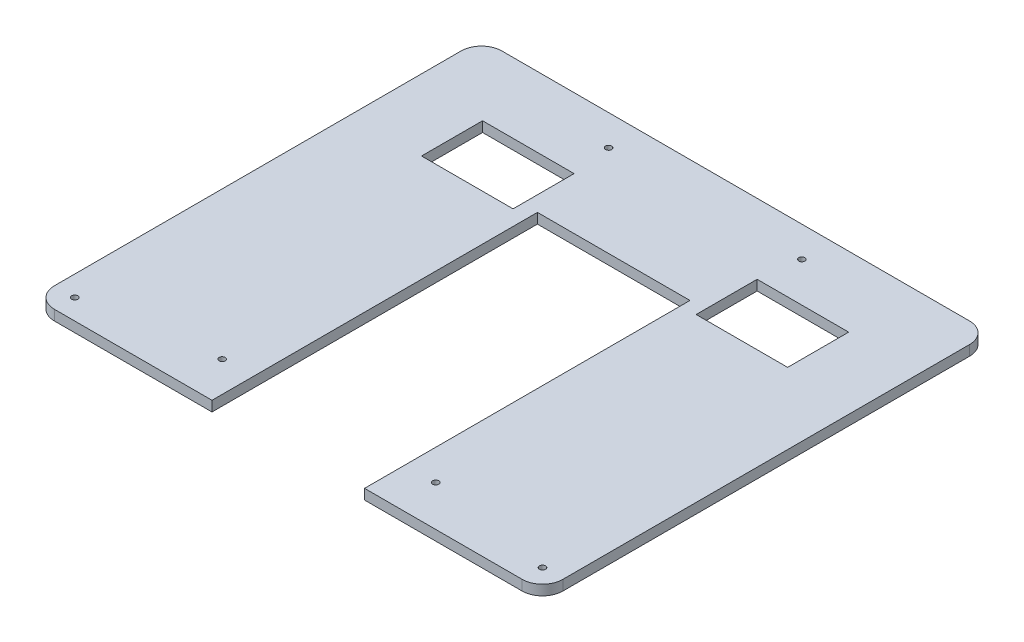
from build123d import *

# Parameters (mm, degrees)
EXTRUDE_1_DEPTH     = 5
SKETCH_4_W          = 45
SKETCH_4_H          = 30
CUT_EXTRUDE_3_DEPTH = 5
SKETCH_5_W          = 75
SKETCH_5_H          = 160
CUT_EXTRUDE_4_DEPTH = 5
CUT_EXTRUDE_5_REACH = 335.054
SKETCH_6_R          = 1.5
CUT_EXTRUDE_9_REACH = 335.054
SKETCH_9_R          = 1.5


with BuildPart() as part:
    # 草图1 → 凸台-拉伸1 (new body)
    with BuildSketch(Plane(origin=(0, 0, 0), x_dir=(1, 0, 0), z_dir=(0, 1, 0))):
        with BuildLine():
            Line((10, 0), (240, 0))
            ThreePointArc((240, 0), (247.071067812, -2.928932188), (250, -10))
            Line((250, -10), (250, -210))
            ThreePointArc((250, -210), (247.071067812, -217.071067812), (240, -220))
            Line((240, -220), (10, -220))
            ThreePointArc((10, -220), (2.928932188, -217.071067812), (0, -210))
            Line((0, -210), (0, -10))
            ThreePointArc((0, -10), (2.928932188, -2.928932188), (10, 0))
        make_face()
    extrude(amount=EXTRUDE_1_DEPTH)

    # 草图4 → 切除-拉伸3 (cut)
    with BuildSketch(Plane.XZ):
        with Locations((192.5, 49.475)):
            Rectangle(SKETCH_4_W, SKETCH_4_H)
        with Locations((57.5, 49.475)):
            Rectangle(SKETCH_4_W, SKETCH_4_H)
    extrude(amount=-CUT_EXTRUDE_3_DEPTH, mode=Mode.SUBTRACT)

    # 草图5 → 切除-拉伸4 (cut)
    with BuildSketch(Plane.XZ):
        with Locations((125, 140)):
            Rectangle(SKETCH_5_W, SKETCH_5_H)
    extrude(amount=-CUT_EXTRUDE_4_DEPTH, mode=Mode.SUBTRACT)

    # 草图6 → 切除-拉伸5 (cut, up to next)
    with BuildSketch(Plane.XZ, mode=Mode.PRIVATE) as cut_extrude_5_sk1:
        with Locations((72.5, 200)):
            Circle(SKETCH_6_R)
    cut_extrude_5_tool1 = extrude(cut_extrude_5_sk1.sketch, amount=-CUT_EXTRUDE_5_REACH, mode=Mode.PRIVATE) & part.part
    # 草图6 → 切除-拉伸5 (cut, up to next)
    with BuildSketch(Plane.XZ, mode=Mode.PRIVATE) as cut_extrude_5_sk2:
        with Locations((177.5, 200)):
            Circle(SKETCH_6_R)
    cut_extrude_5_tool2 = extrude(cut_extrude_5_sk2.sketch, amount=-CUT_EXTRUDE_5_REACH, mode=Mode.PRIVATE) & part.part
    add(cut_extrude_5_tool1.solids().sort_by_distance((72.5, 0, 200))[0], mode=Mode.SUBTRACT)
    add(cut_extrude_5_tool2.solids().sort_by_distance((177.5, 0, 200))[0], mode=Mode.SUBTRACT)

    # 草图9 → 切除-拉伸9 (cut, up to next)
    with BuildSketch(Plane.XZ, mode=Mode.PRIVATE) as cut_extrude_9_sk1:
        with Locations((77.5, 15)):
            Circle(SKETCH_9_R)
    cut_extrude_9_tool1 = extrude(cut_extrude_9_sk1.sketch, amount=-CUT_EXTRUDE_9_REACH, mode=Mode.PRIVATE) & part.part
    # 草图9 → 切除-拉伸9 (cut, up to next)
    with BuildSketch(Plane.XZ, mode=Mode.PRIVATE) as cut_extrude_9_sk2:
        with Locations((10, 210)):
            Circle(SKETCH_9_R)
    cut_extrude_9_tool2 = extrude(cut_extrude_9_sk2.sketch, amount=-CUT_EXTRUDE_9_REACH, mode=Mode.PRIVATE) & part.part
    # 草图9 → 切除-拉伸9 (cut, up to next)
    with BuildSketch(Plane.XZ, mode=Mode.PRIVATE) as cut_extrude_9_sk3:
        with Locations((240, 210)):
            Circle(SKETCH_9_R)
    cut_extrude_9_tool3 = extrude(cut_extrude_9_sk3.sketch, amount=-CUT_EXTRUDE_9_REACH, mode=Mode.PRIVATE) & part.part
    # 草图9 → 切除-拉伸9 (cut, up to next)
    with BuildSketch(Plane.XZ, mode=Mode.PRIVATE) as cut_extrude_9_sk4:
        with Locations((172.5, 15)):
            Circle(SKETCH_9_R)
    cut_extrude_9_tool4 = extrude(cut_extrude_9_sk4.sketch, amount=-CUT_EXTRUDE_9_REACH, mode=Mode.PRIVATE) & part.part
    add(cut_extrude_9_tool1.solids().sort_by_distance((77.5, 0, 15))[0], mode=Mode.SUBTRACT)
    add(cut_extrude_9_tool2.solids().sort_by_distance((10, 0, 210))[0], mode=Mode.SUBTRACT)
    add(cut_extrude_9_tool3.solids().sort_by_distance((240, 0, 210))[0], mode=Mode.SUBTRACT)
    add(cut_extrude_9_tool4.solids().sort_by_distance((172.5, 0, 15))[0], mode=Mode.SUBTRACT)


solid = part.part
